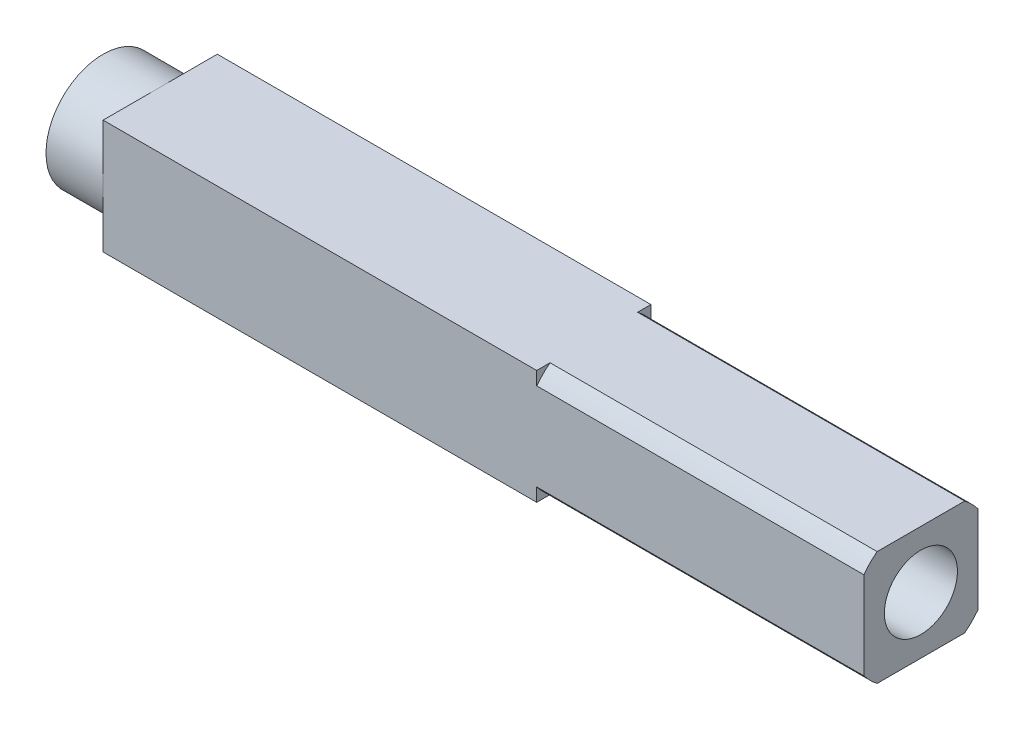
from build123d import *

# Parameters (mm, degrees)
SKETCH1_W           = 6.35
SKETCH1_H           = 6.35
BOSS_EXTRUDE1_DEPTH = 27.28214
SKETCH3_W           = 9.525
SKETCH3_H           = 9.525
SKETCH3_R           = 3.175
CUT_EXTRUDE2_DEPTH  = 3.175
BOSS_EXTRUDE2_DEPTH = 18.18386
SKETCH5_R           = 2.032
CUT_EXTRUDE3_DEPTH  = 25.4


with BuildPart() as part:
    # Sketch1 → Boss-Extrude1 (new body)
    with BuildSketch(Plane(origin=(0, 0, 0), x_dir=(0, 0, -1), z_dir=(1, 0, 0))):
        Rectangle(SKETCH1_W, SKETCH1_H)
    extrude(amount=BOSS_EXTRUDE1_DEPTH)

    # Sketch3 → Cut-Extrude2 (cut)
    with BuildSketch(Plane.ZY):
        Rectangle(SKETCH3_W, SKETCH3_H)
        Circle(SKETCH3_R, mode=Mode.SUBTRACT)
    extrude(amount=-CUT_EXTRUDE2_DEPTH, mode=Mode.SUBTRACT)

    # Sketch4 → Boss-Extrude2 (add)
    with BuildSketch(Plane(origin=(27.28214, 0, 0), x_dir=(0, 0, -1), z_dir=(1, 0, 0))):
        with BuildLine():
            Line((3.175, -2.432976572), (3.175, 2.432976572))
            ThreePointArc((3.175, 2.432976572), (2.828427125, 2.828427125), (2.432976572, 3.175))
            Line((2.432976572, 3.175), (-2.432976572, 3.175))
            ThreePointArc((-2.432976572, 3.175), (-2.828427125, 2.828427125), (-3.175, 2.432976572))
            Line((-3.175, 2.432976572), (-3.175, -2.432976572))
            ThreePointArc((-3.175, -2.432976572), (-2.828427125, -2.828427125), (-2.432976572, -3.175))
            Line((-2.432976572, -3.175), (2.432976572, -3.175))
            ThreePointArc((2.432976572, -3.175), (2.828427125, -2.828427125), (3.175, -2.432976572))
        make_face()
    extrude(amount=BOSS_EXTRUDE2_DEPTH)

    # Sketch5 → Cut-Extrude3 (cut)
    with BuildSketch(Plane(origin=(45.466, 0, 0), x_dir=(0, 0, -1), z_dir=(1, 0, 0))):
        Circle(SKETCH5_R)
    extrude(amount=-CUT_EXTRUDE3_DEPTH, mode=Mode.SUBTRACT)


solid = part.part
